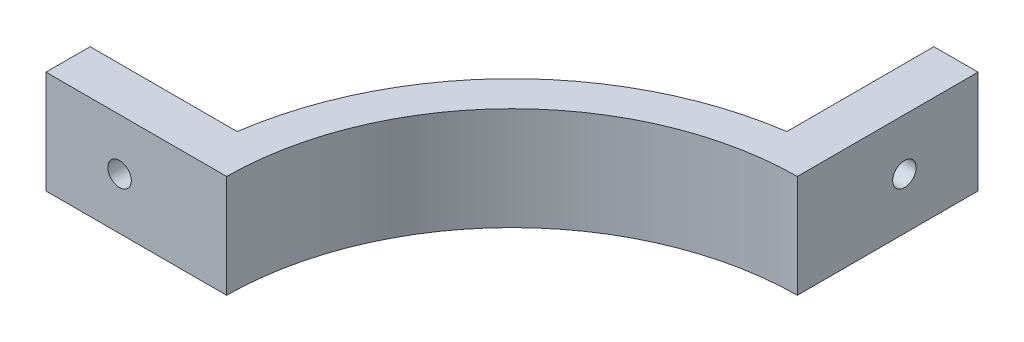
from build123d import *

# Parameters (mm, degrees)
BOSS_EXTRUDE1_DEPTH             = 3.5
M2X0_4_TAPPED_HOLE3_D           = 1.6
M2X0_4_TAPPED_HOLE3_ON_FACE_2_D = 1.6


with BuildPart() as part:
    # Sketch1 → Boss-Extrude1 (new, symmetric)
    with BuildSketch(Plane(origin=(0, 0, 0), x_dir=(1, 0, 0), z_dir=(0, 1, 0))):
        with BuildLine():
            Line((-3.1, 31.780495862), (-3.1, 21.780495862))
            ThreePointArc((-3.1, 21.780495862), (-15.556349186, 15.556349186), (-21.780495862, 3.1))
            Line((-21.780495862, 3.1), (-31.780495862, 3.1))
            Line((-31.780495862, 3.1), (-31.780495862, 0.1))
            Line((-31.780495862, 0.1), (-19.499743588, 0.1))
            ThreePointArc((-19.499743588, 0.1), (-13.788582233, 13.788582233), (-0.1, 19.499743588))
            Line((-0.1, 19.499743588), (-0.1, 31.780495862))
            Line((-0.1, 31.780495862), (-3.1, 31.780495862))
        make_face()
    extrude(amount=BOSS_EXTRUDE1_DEPTH, both=True)

    # M2x0.4 Tapped Hole3 (through all)
    with Locations(Plane(origin=(-0.1, 0, -26.780495862), x_dir=(0, 0, 1), z_dir=(1, 0, 0))):
        with Locations((0, 0)):
            Hole(M2X0_4_TAPPED_HOLE3_D / 2)

    # M2x0.4 Tapped Hole3 on face 2 (through all)
    with Locations(Plane(origin=(-26.780495862, 0, -3.1), x_dir=(-1, 0, 0), z_dir=(0, 0, -1))):
        with Locations((0, 0)):
            Hole(M2X0_4_TAPPED_HOLE3_ON_FACE_2_D / 2)


solid = part.part
